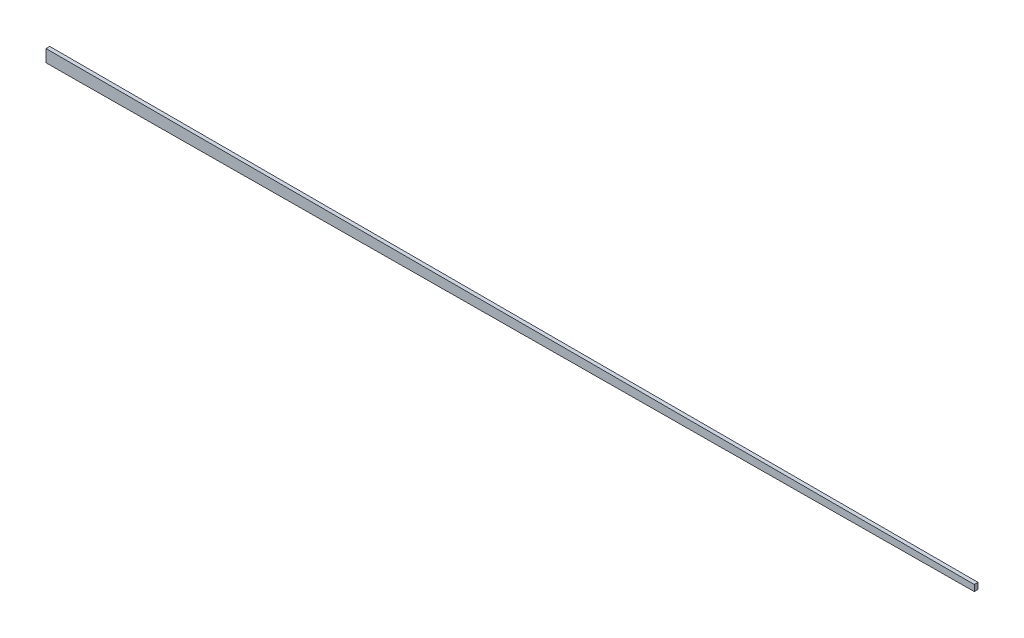
from build123d import *

# Parameters (mm, degrees)
BOSS_EXTRUDE1_DEPTH = 3


with BuildPart() as part:
    # Sketch1 → Boss-Extrude1 (new body)
    with BuildSketch(Plane.XY):
        Polygon((0, 0), (750, 5), (750, 10), (0, 10), align=None)
    extrude(amount=BOSS_EXTRUDE1_DEPTH)


solid = part.part
